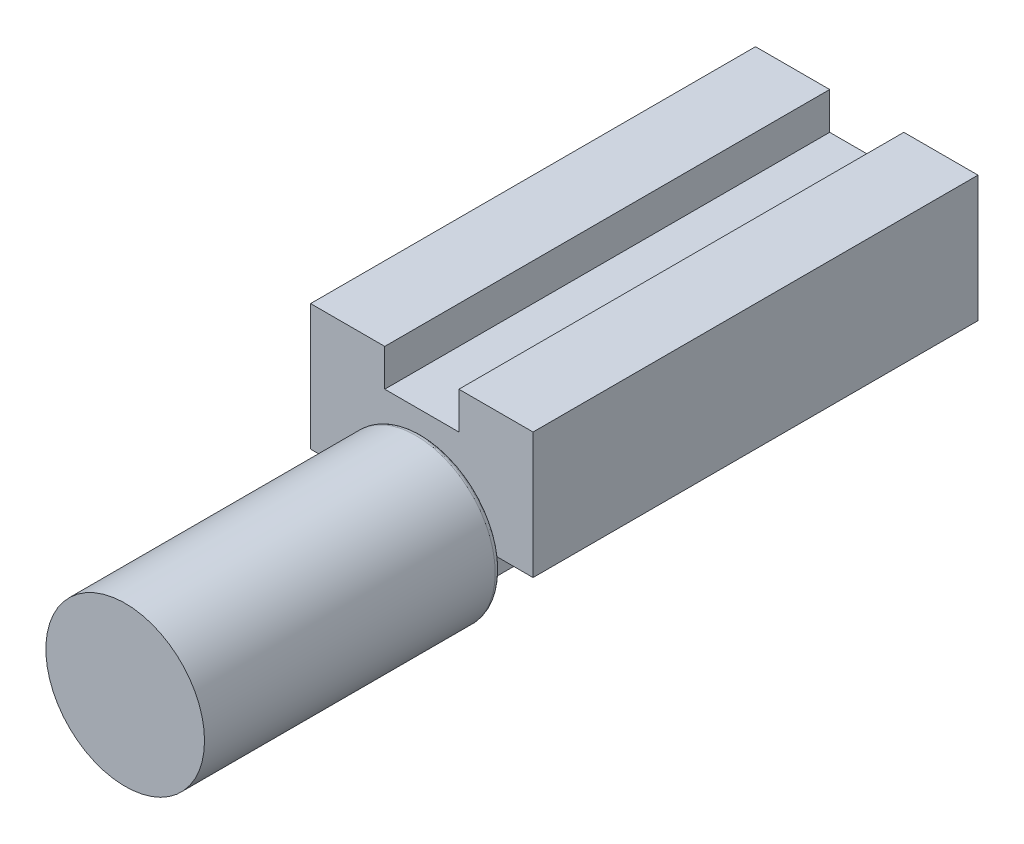
from build123d import *

# Parameters (mm, degrees)
BOSS_EXTRUDE1_DEPTH = 25.6413
SKETCH2_W           = 8.5471
SKETCH2_H           = 1.025652
BOSS_EXTRUDE2_DEPTH = 12.82065
SKETCH3_R           = 4.572
BOSS_EXTRUDE3_DEPTH = 17.0942
FILLET11_R          = 0.341884


with BuildPart() as part:
    # Sketch1 → Boss-Extrude1 (new body)
    with BuildSketch(Plane.XY):
        Polygon((-38.8493, -0.51054), (-38.8493, 1.626235), (-34.57575, 1.626235), (-34.57575, -5.6388), (-47.3964, -5.6388), (-47.3964, -0.51054), (-47.3964, 1.626235), (-43.12285, 1.626235), (-43.12285, -0.51054), align=None)
    extrude(amount=BOSS_EXTRUDE1_DEPTH)


with BuildPart() as body_2:
    # Sketch2 → Boss-Extrude2 (new body)
    with BuildSketch(Plane.XY.offset(25.6413)):
        with Locations((-40.986075, -6.151626)):
            Rectangle(SKETCH2_W, SKETCH2_H)
    extrude(amount=-BOSS_EXTRUDE2_DEPTH)

    # Sketch3 → Boss-Extrude3 (add)
    with BuildSketch(Plane.XY.offset(25.6413)):
        with Locations((-40.986075, -6.151626)):
            Circle(SKETCH3_R)
    extrude(amount=BOSS_EXTRUDE3_DEPTH)

    # Fillet11
    # the kernel refuses this fillet: 0.341884 mm, written as the material it takes off along each edge
    with BuildSketch(Plane(origin=(-40.986075, -6.151626, 25.6413), x_dir=(1, 0, 0), z_dir=(0, -1, 0))) as fillet11_piece_1_section:
        with BuildLine():
            CenterArc((4.572 - FILLET11_R, FILLET11_R), FILLET11_R, 270, 90)
            Line((4.572 - FILLET11_R, 0), (4.572, 0))
            Line((4.572, 0), (4.572, FILLET11_R))
        make_face()
    fillet11_piece_1 = revolve(axis=Axis((-40.986075, -6.151626, 25.6413), (0, 0, 1)), mode=Mode.PRIVATE)
    fillet11_piece_1 = split(fillet11_piece_1, bisect_by=Plane(origin=(-36.712525, -6.151626373, 25.717911182), z_dir=(1, 0, 0)), keep=Keep.TOP, mode=Mode.PRIVATE)
    add(fillet11_piece_1, mode=Mode.SUBTRACT)
    with BuildSketch(Plane(origin=(-40.986075, -6.151626, 25.6413), x_dir=(1, 0, 0), z_dir=(0, -1, 0))) as fillet11_piece_2_section:
        with BuildLine():
            CenterArc((4.572 - FILLET11_R, FILLET11_R), FILLET11_R, 270, 90)
            Line((4.572 - FILLET11_R, 0), (4.572, 0))
            Line((4.572, 0), (4.572, FILLET11_R))
        make_face()
    fillet11_piece_2 = revolve(axis=Axis((-40.986075, -6.151626, 25.6413), (0, 0, 1)), mode=Mode.PRIVATE)
    fillet11_piece_2 = split(fillet11_piece_2, bisect_by=Plane(origin=(-40.986075, -5.6388, 25.736787981), z_dir=(0, 1, 0)), keep=Keep.TOP, mode=Mode.PRIVATE)
    add(fillet11_piece_2, mode=Mode.SUBTRACT)
    with BuildSketch(Plane(origin=(-40.986075, -6.151626, 25.6413), x_dir=(1, 0, 0), z_dir=(0, -1, 0))) as fillet11_piece_3_section:
        with BuildLine():
            CenterArc((4.572 - FILLET11_R, FILLET11_R), FILLET11_R, 270, 90)
            Line((4.572 - FILLET11_R, 0), (4.572, 0))
            Line((4.572, 0), (4.572, FILLET11_R))
        make_face()
    fillet11_piece_3 = revolve(axis=Axis((-40.986075, -6.151626, 25.6413), (0, 0, 1)), mode=Mode.PRIVATE)
    fillet11_piece_3 = split(fillet11_piece_3, bisect_by=Plane(origin=(-36.749842277, -6.664452, 25.642654228), z_dir=(0, -1, 0)), keep=Keep.TOP, mode=Mode.PRIVATE)
    add(fillet11_piece_3, mode=Mode.SUBTRACT)
    with BuildSketch(Plane(origin=(-40.986075, -6.151626, 25.6413), x_dir=(1, 0, 0), z_dir=(0, -1, 0))) as fillet11_piece_4_section:
        with BuildLine():
            CenterArc((4.572 - FILLET11_R, FILLET11_R), FILLET11_R, 270, 90)
            Line((4.572 - FILLET11_R, 0), (4.572, 0))
            Line((4.572, 0), (4.572, FILLET11_R))
        make_face()
    fillet11_piece_4 = revolve(axis=Axis((-40.986075, -6.151626, 25.6413), (0, 0, 1)), mode=Mode.PRIVATE)
    fillet11_piece_4 = split(fillet11_piece_4, bisect_by=Plane(origin=(-45.259625, -6.151625497, 25.717911335), z_dir=(-1, 0, 0)), keep=Keep.TOP, mode=Mode.PRIVATE)
    add(fillet11_piece_4, mode=Mode.SUBTRACT)


solid = Compound([part.part, body_2.part])
